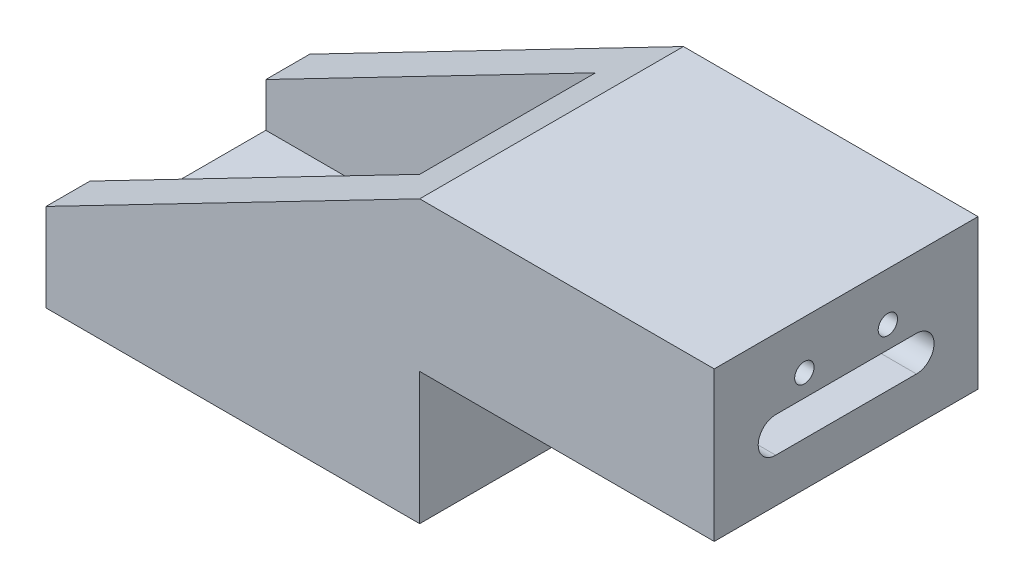
from build123d import *

# Parameters (mm, degrees)
BOSS_EXTRUDE1_DEPTH     = 15
CUT_EXTRUDE1_DEPTH      = 75.866547937
CUT_EXTRUDE1_DEPTH_BACK = 75.866547937
SKETCH3_R               = 4
SKETCH3_R_2             = 1.55
CUT_EXTRUDE3_DEPTH      = 84.815273071
CUT_EXTRUDE3_DEPTH_BACK = 84.815273071
SKETCH5_R               = 1.1
SKETCH4_W               = 42.5
SKETCH4_H               = 20
CUT_EXTRUDE5_DEPTH      = 73.869746809


with BuildPart() as part:
    # Sketch1 → Boss-Extrude1 (new, symmetric)
    with BuildSketch(Plane.XY):
        Polygon((0, 0), (-10, 0), (-10, 10), (32.5, 32), (66, 32), (66, 15), (32.5, 15), (32.5, 0), align=None)
    extrude(amount=BOSS_EXTRUDE1_DEPTH, both=True)

    # Sketch3 → Cut-Extrude1 (cut, two sides: drawn at the far end of the back side and taken through both)
    with BuildSketch(Plane.XZ.offset(-CUT_EXTRUDE1_DEPTH_BACK)):
        Circle(SKETCH3_R)
        with Locations((20, 0)):
            Circle(SKETCH3_R_2)
    extrude(amount=CUT_EXTRUDE1_DEPTH + CUT_EXTRUDE1_DEPTH_BACK, mode=Mode.SUBTRACT)

    # Sketch5 → Cut-Extrude3 (cut, two sides: drawn at the far end of the back side and taken through both)
    with BuildSketch(Plane(origin=(66, 0, 0), x_dir=(0, 0, -1), z_dir=(1, 0, 0)).offset(-CUT_EXTRUDE3_DEPTH_BACK)):
        with Locations((-4.75, 26.5)):
            Circle(SKETCH5_R)
        with Locations((4.75, 26.5)):
            Circle(SKETCH5_R)
        with BuildLine():
            Line((-8, 20), (8, 20))
            ThreePointArc((8, 20), (10, 22), (8, 24))
            Line((8, 24), (-8, 24))
            ThreePointArc((-8, 24), (-10, 22), (-8, 20))
        make_face()
    extrude(amount=CUT_EXTRUDE3_DEPTH + CUT_EXTRUDE3_DEPTH_BACK, mode=Mode.SUBTRACT)

    # Sketch4 → Cut-Extrude5 (cut, through all)
    with BuildSketch(Plane(origin=(0, 5, 0), x_dir=(1, 0, 0), z_dir=(0, 1, 0))):
        with Locations((6.25, 0)):
            Rectangle(SKETCH4_W, SKETCH4_H)
    extrude(amount=CUT_EXTRUDE5_DEPTH, mode=Mode.SUBTRACT)


solid = part.part
